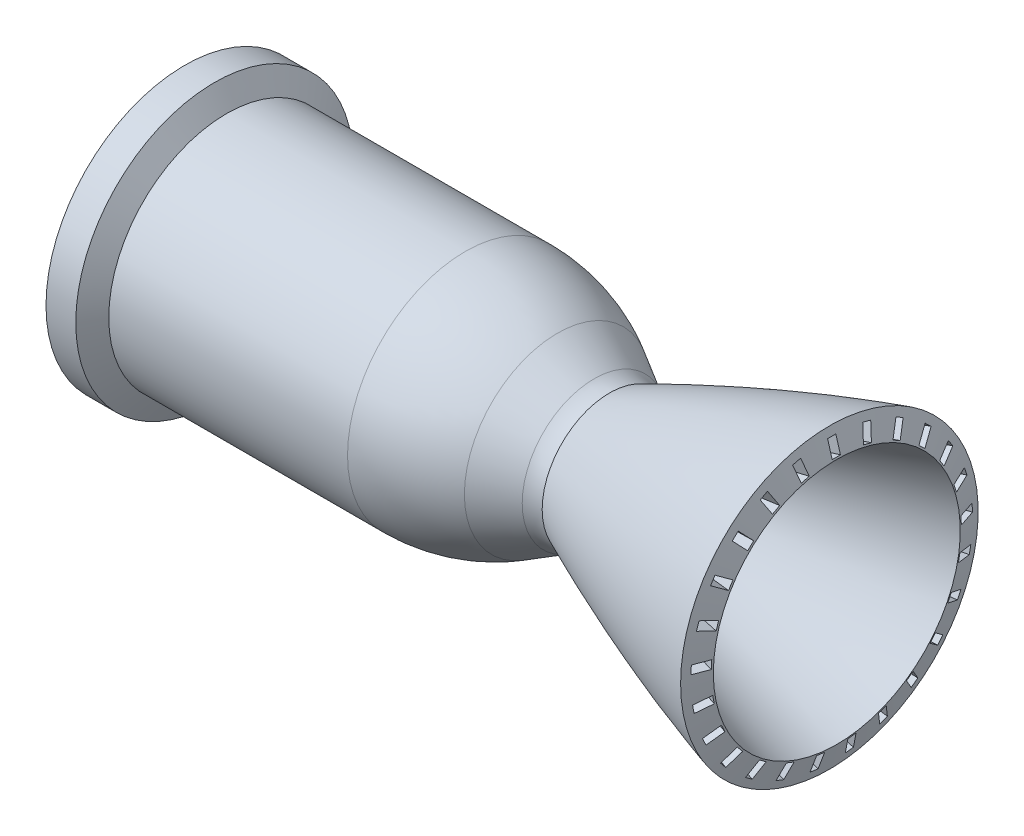
from build123d import *

# Parameters (mm, degrees)
CUT_EXTRUDE1_DEPTH = 2.5
CIRPATTERN1_COUNT  = 25


with BuildPart() as part:
    # Sketch12 → Revolve1 (revolve)
    with BuildSketch(Plane.XY):
        with BuildLine():
            Line((192.877031349, 42.655012217), (215.127149697, 29.808876046))
            ThreePointArc((215.127149697, 29.808876046), (224.106622413, 26.089455548), (233.742783423, 24.820826336))
            ThreePointArc((233.742783423, 24.820826336), (235.713203517, 25.027826984), (237.597587303, 25.639792966))
            add(Edge.make_bspline(
                [(237.597587303, 25.639792966), (305.794911856, 55.987196879), (370.436287167, 74.957098261)],
                knots=[0, 0, 0, 1, 1, 1], degree=2))
            Line((370.436287167, 74.957098261), (365.9308663, 90.309661005))
            add(Edge.make_bspline(
                [(232.448772375, 40.860298318), (235.288313068, 42.119870513), (240.989702131, 44.623565221), (252.326293683, 49.500164323), (266.444579185, 55.382363387), (283.280281433, 62.089102177), (300.016037513, 68.44637441), (316.650015055, 74.453066066), (333.184213289, 80.109477761), (346.875161173, 84.529642093), (357.785345668, 87.892399224), (363.209456788, 89.511025923), (365.9308663, 90.309661005)],
                knots=[0.492875939, 0.492875939, 0.492875939, 0.492875939, 0.492982773, 0.493089606, 0.493303273, 0.49351694, 0.493730607, 0.493944274, 0.494157941, 0.494371608, 0.494478441, 0.494585275, 0.494585275, 0.494585275, 0.494585275], degree=3))
            ThreePointArc((232.448772375, 40.860298318), (227.625034583, 41.721337074), (223.127154881, 43.665279514))
            Line((223.127154881, 43.665279514), (200.877042723, 56.51141211))
            ThreePointArc((200.877042723, 56.51141211), (173.892574508, 67.688769671), (144.934666475, 71.5011717))
            Line((144.934666475, 71.5011717), (0, 71.5011717))
            Line((0, 71.5011717), (0, 55.5011717))
            Line((0, 55.5011717), (144.9346606, 55.5011717))
            ThreePointArc((144.9346606, 55.5011717), (169.751460606, 52.23395891), (192.877031349, 42.655012217))
        make_face()
    revolve(axis=Axis((0, 0, 0), (1, 0, 0)))

    # Sketch14 → Cut-Extrude1 (cut, symmetric)
    with BuildSketch(Plane.XY):
        with BuildLine():
            Line((0, 56.5011717), (144.9346606, 56.5011717))
            ThreePointArc((144.9346606, 56.5011717), (170.010280047, 53.199884631), (193.37703206, 43.52103721))
            Line((193.37703206, 43.52103721), (215.627150408, 30.674901039))
            ThreePointArc((215.627150408, 30.674901039), (224.365442165, 27.055381185), (233.742784066, 25.820826336))
            ThreePointArc((233.742784066, 25.820826336), (235.505387918, 26.005995004), (237.191029569, 26.553418058))
            add(Edge.make_bspline(
                [(237.191029569, 26.553418058), (240.025534279, 27.8147558), (245.717538779, 30.322135318), (257.030896399, 35.203337243), (271.115022203, 41.087742893), (287.900335796, 47.791190853), (304.576429084, 54.139617119), (321.141223753, 60.132134602), (337.596678254, 65.769364025), (351.213691495, 70.169553184), (362.060225845, 73.514258315), (367.450089198, 75.122928644), (370.154698363, 75.916633432)],
                knots=[0.492858989, 0.492858989, 0.492858989, 0.492858989, 0.492966882, 0.493074775, 0.493290561, 0.493506346, 0.493722132, 0.493937918, 0.494153704, 0.494369489, 0.494477382, 0.494585275, 0.494585275, 0.494585275, 0.494585275], degree=3))
            Line((370.154698363, 75.916633432), (367.338810321, 85.511985147))
            add(Edge.make_bspline(
                [(233.424633311, 35.822756061), (236.27560973, 37.090533131), (242.000308428, 39.610577207), (253.381433842, 44.517771306), (267.553222563, 50.435153911), (284.449058554, 57.179019377), (301.240978582, 63.568477749), (317.927052832, 69.602478102), (334.509285994, 75.281429109), (348.23672439, 79.716446991), (359.174228594, 83.088859856), (364.610919974, 84.711448175), (367.338810321, 85.511985147)],
                knots=[0.492862743, 0.492862743, 0.492862743, 0.492862743, 0.492970401, 0.493078059, 0.493293376, 0.493508692, 0.493724009, 0.493939325, 0.494154642, 0.494369958, 0.494477617, 0.494585275, 0.494585275, 0.494585275, 0.494585275], degree=3))
            ThreePointArc((233.424633311, 35.822756061), (226.800103593, 36.756276843), (220.627157517, 39.335150973))
            Line((220.627157517, 39.335150973), (198.377039169, 52.181287144))
            ThreePointArc((198.377039169, 52.181287144), (172.598474463, 62.859141831), (144.9346606, 66.5011717))
            Line((144.9346606, 66.5011717), (0, 66.5011717))
            Line((0, 66.5011717), (0, 56.5011717))
        make_face()
    cut_extrude1 = extrude(amount=CUT_EXTRUDE1_DEPTH, both=True, mode=Mode.SUBTRACT)

    # CirPattern1: Cut-Extrude1 ×25 about axis
    cirpattern1_axis = Axis((0, 0, 0), (1, 0, 0))
    for i in range(1, CIRPATTERN1_COUNT):
        add(cut_extrude1.rotate(cirpattern1_axis, i * 360 / CIRPATTERN1_COUNT), mode=Mode.SUBTRACT)

    # Sketch15 → Revolve2 (revolve)
    with BuildSketch(Plane.XY):
        Polygon((0, 71.5011717), (-7.332348419, 84.2011717), (-25.4, 84.2011717), (-25.4, 66.5011717), (0, 66.5011717), align=None)
    revolve(axis=Axis((0, 0, 0), (1, 0, 0)))


solid = part.part
